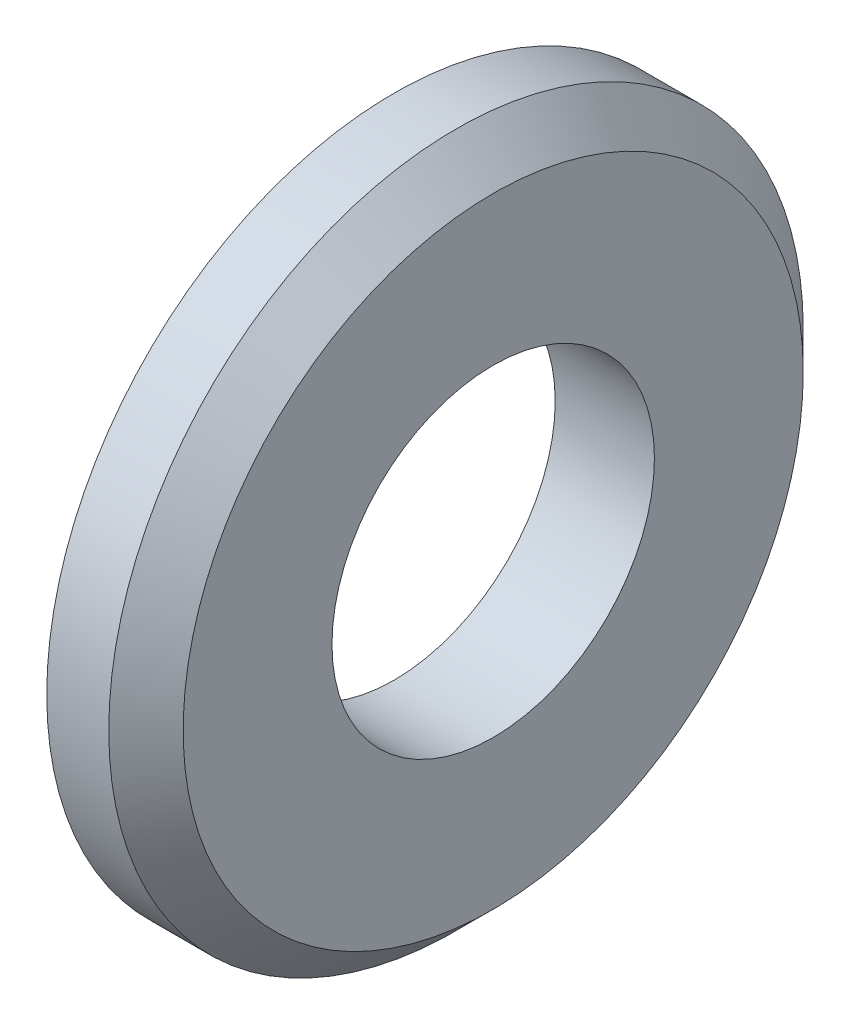
from build123d import *

# Parameters (mm, degrees)
SKETCH_1_W     = 4
SKETCH_1_H     = 7.5
CHAMFER_2_SIZE = 1.5


with BuildPart() as part:
    # 草图1 → 旋转1 (revolve)
    with BuildSketch(Plane.XY):
        with Locations((-2, 10.25)):
            Rectangle(SKETCH_1_W, SKETCH_1_H)
    revolve(axis=Axis((0, 0, 0), (-1, 0, 0)))

    # 倒角2
    chamfer_2_edges = [part.edges().sort_by_distance(p)[0] for p in [
        (0, -14, 0),
    ]]
    chamfer(chamfer_2_edges, length=CHAMFER_2_SIZE)


solid = part.part
